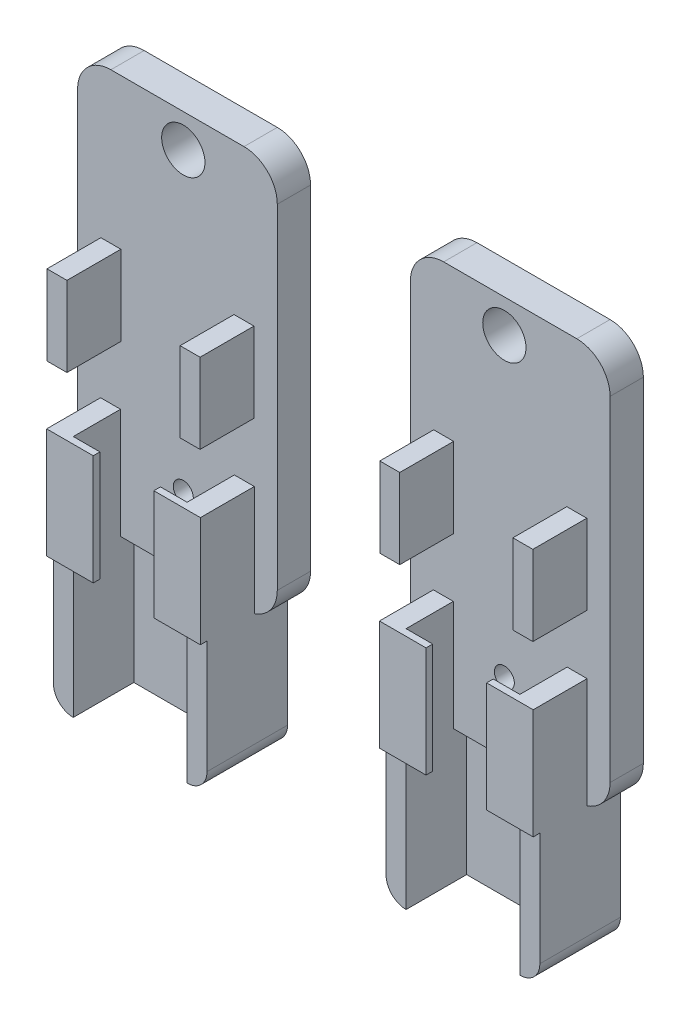
from build123d import *

# Parameters (mm, degrees)
SKETCH_1_W          = 30
SKETCH_1_H          = 60
EXTRUDE_1_DEPTH     = 5
SKETCH_2_R          = 3.25
SKETCH_2_R_2        = 1.5
CUT_EXTRUDE_1_DEPTH = 10
SKETCH_3_W          = 3
SKETCH_3_H          = 16.55
SKETCH_3_W_2        = 2.999297591
SKETCH_3_H_2        = 12
EXTRUDE_2_DEPTH     = 8.1
SKETCH_4_W          = 1
SKETCH_4_H          = 16.55
EXTRUDE_3_DEPTH     = 4
SKETCH_5_W          = 1
SKETCH_5_H          = 16.55
EXTRUDE_4_DEPTH     = 4
EXTRUDE_5_DEPTH     = 20
FILLET_3_R          = 5
FILLET_5_R          = 3
FILLET_6_R          = 5
FILLET_7_R          = 3


with BuildPart() as part:
    # 스케치1 → 보스-돌출1 (new body)
    with BuildSketch(Plane.XY):
        with Locations((15, -30)):
            Rectangle(SKETCH_1_W, SKETCH_1_H)
    extrude(amount=EXTRUDE_1_DEPTH)

    # 스케치2 → 컷-돌출1 (cut)
    with BuildSketch(Plane.XY.offset(5)):
        with Locations((15.88, -5)):
            Circle(SKETCH_2_R)
        with Locations((15.88, -49.5)):
            Circle(SKETCH_2_R_2)
    extrude(amount=-CUT_EXTRUDE_1_DEPTH, mode=Mode.SUBTRACT)

    # 스케치3 → 보스-돌출2 (add)
    with BuildSketch(Plane.XY.offset(5)):
        with Locations((4.95, -51.725)):
            Rectangle(SKETCH_3_W, SKETCH_3_H)
        with Locations((25.049648796, -51.725)):
            Rectangle(SKETCH_3_W_2, SKETCH_3_H)
        with Locations((5, -28.602177849)):
            Rectangle(SKETCH_3_W, SKETCH_3_H_2)
        with Locations((25, -28.602177849)):
            Rectangle(SKETCH_3_W, SKETCH_3_H_2)
    extrude(amount=EXTRUDE_2_DEPTH)

    # 스케치4 → 보스-돌출3 (add)
    with BuildSketch(Plane(origin=(6.45, 0, 0), x_dir=(0, 0, -1), z_dir=(1, 0, 0))):
        with Locations((-12.6, -51.725)):
            Rectangle(SKETCH_4_W, SKETCH_4_H)
    extrude(amount=EXTRUDE_3_DEPTH)

    # 스케치5 → 보스-돌출4 (add)
    with BuildSketch(Plane.ZY.offset(-23.55)):
        with Locations((12.6, -51.725)):
            Rectangle(SKETCH_5_W, SKETCH_5_H)
    extrude(amount=EXTRUDE_4_DEPTH)

    # 스케치6 → 보스-돌출5 (add)
    with BuildSketch(Plane.XZ.offset(60)):
        Polygon((3.45, 0), (26.549297591, 0), (26.549297591, 3), (26.549297591, 12.1), (23.55, 12.1), (23.55, 3), (6.45, 3), (6.45, 12.1), (3.45, 12.1), (3.45, 3), align=None)
    extrude(amount=EXTRUDE_5_DEPTH)


with BuildPart() as body_2:
    # 대칭 복사8: mirrored copy
    add(part.part.mirror(Plane(origin=(40, 0, 0), x_dir=(0, 0, 1), z_dir=(1, 0, 0))))

    # 필렛6
    # the kernel refuses this fillet: 5 mm, written as the material it takes off along each edge
    with BuildSketch(Plane(origin=(50, -60, -11.884779388), x_dir=(0, 1, 0), z_dir=(0, 0, 1))) as fillet_6_piece_1:
        with BuildLine():
            CenterArc((4.753911755, -5), FILLET_6_R, 90, 71.949235391)
            Line((0, -3.450702409), (-0.095078235, -3.419716457))
            ThreePointArc((-0.095078235, -3.419716457), (-0.1, -1.725351205), (-0.1, 0))
            Line((-0.1, 0), (0, 0.1))
            Line((0, 0.1), (4.753911755, 0.1))
            Line((4.753911755, 0.1), (4.753911755, 0))
        make_face()
    extrude(amount=28.769558776, mode=Mode.SUBTRACT)
    with BuildSketch(Plane(origin=(80, -60, -11.884206957), x_dir=(0, 1, 0), z_dir=(0, 0, 1))) as fillet_6_piece_2:
        with BuildLine():
            CenterArc((4.753682783, 5), FILLET_6_R, 198.059230491, 71.940769509)
            Line((0, 3.45), (-0.095073656, 3.419))
            ThreePointArc((-0.095073656, 3.419), (-0.1, 1.725), (-0.1, 0))
            Line((-0.1, 0), (0, -0.1))
            Line((0, -0.1), (4.753682783, -0.1))
            Line((4.753682783, -0.1), (4.753682783, 0))
        make_face()
    extrude(amount=28.768413914, mode=Mode.SUBTRACT)
    with BuildSketch(Plane(origin=(50, 0, -12.5), x_dir=(1, 0, 0), z_dir=(0, 0, 1))) as fillet_6_piece_3:
        with BuildLine():
            CenterArc((FILLET_6_R, -FILLET_6_R), FILLET_6_R, 90, 90)
            Line((0, -FILLET_6_R), (-FILLET_6_R * 0.02, -FILLET_6_R))
            Line((-FILLET_6_R * 0.02, -FILLET_6_R), (-FILLET_6_R * 0.02, FILLET_6_R * 0.02))
            Line((-FILLET_6_R * 0.02, FILLET_6_R * 0.02), (FILLET_6_R, FILLET_6_R * 0.02))
            Line((FILLET_6_R, FILLET_6_R * 0.02), (FILLET_6_R, 0))
        make_face()
    extrude(amount=30, mode=Mode.SUBTRACT)
    with BuildSketch(Plane(origin=(80, 0, -12.5), x_dir=(-1, 0, 0), z_dir=(0, 0, 1))) as fillet_6_piece_4:
        with BuildLine():
            CenterArc((FILLET_6_R, FILLET_6_R), FILLET_6_R, 180, 90)
            Line((0, FILLET_6_R), (-FILLET_6_R * 0.02, FILLET_6_R))
            Line((-FILLET_6_R * 0.02, FILLET_6_R), (-FILLET_6_R * 0.02, -FILLET_6_R * 0.02))
            Line((-FILLET_6_R * 0.02, -FILLET_6_R * 0.02), (FILLET_6_R, -FILLET_6_R * 0.02))
            Line((FILLET_6_R, -FILLET_6_R * 0.02), (FILLET_6_R, 0))
        make_face()
    extrude(amount=30, mode=Mode.SUBTRACT)

    # 필렛7
    fillet_7_edges = [body_2.edges().sort_by_distance(p)[0] for p in [
        (53.450702409, -80, 6.05),
        (76.55, -80, 6.05),
    ]]
    fillet(fillet_7_edges, radius=FILLET_7_R)


with BuildPart() as part_1:
    add(part.part)

    # 필렛3
    # the kernel refuses this fillet: 5 mm, written as the material it takes off along each edge
    with BuildSketch(Plane(origin=(30, -60, -11.884779388), x_dir=(0, 1, 0), z_dir=(0, 0, 1))) as fillet_3_piece_1:
        with BuildLine():
            CenterArc((4.753911755, 5), FILLET_3_R, 198.050764609, 71.949235391)
            Line((0, 3.450702409), (-0.095078235, 3.419716457))
            ThreePointArc((-0.095078235, 3.419716457), (-0.1, 1.725351205), (-0.1, 0))
            Line((-0.1, 0), (0, -0.1))
            Line((0, -0.1), (4.753911755, -0.1))
            Line((4.753911755, -0.1), (4.753911755, 0))
        make_face()
    extrude(amount=28.769558776, mode=Mode.SUBTRACT)
    with BuildSketch(Plane(origin=(0, -60, -11.884206957), x_dir=(0, 1, 0), z_dir=(0, 0, 1))) as fillet_3_piece_2:
        with BuildLine():
            CenterArc((4.753682783, -5), FILLET_3_R, 90, 71.940769509)
            Line((0, -3.45), (-0.095073656, -3.419))
            ThreePointArc((-0.095073656, -3.419), (-0.1, -1.725), (-0.1, 0))
            Line((-0.1, 0), (0, 0.1))
            Line((0, 0.1), (4.753682783, 0.1))
            Line((4.753682783, 0.1), (4.753682783, 0))
        make_face()
    extrude(amount=28.768413914, mode=Mode.SUBTRACT)
    with BuildSketch(Plane(origin=(30, 0, -12.5), x_dir=(-1, 0, 0), z_dir=(0, 0, 1))) as fillet_3_piece_3:
        with BuildLine():
            CenterArc((FILLET_3_R, FILLET_3_R), FILLET_3_R, 180, 90)
            Line((0, FILLET_3_R), (-FILLET_3_R * 0.02, FILLET_3_R))
            Line((-FILLET_3_R * 0.02, FILLET_3_R), (-FILLET_3_R * 0.02, -FILLET_3_R * 0.02))
            Line((-FILLET_3_R * 0.02, -FILLET_3_R * 0.02), (FILLET_3_R, -FILLET_3_R * 0.02))
            Line((FILLET_3_R, -FILLET_3_R * 0.02), (FILLET_3_R, 0))
        make_face()
    extrude(amount=30, mode=Mode.SUBTRACT)
    with BuildSketch(Plane(origin=(0, 0, -12.5), x_dir=(1, 0, 0), z_dir=(0, 0, 1))) as fillet_3_piece_4:
        with BuildLine():
            CenterArc((FILLET_3_R, -FILLET_3_R), FILLET_3_R, 90, 90)
            Line((0, -FILLET_3_R), (-FILLET_3_R * 0.02, -FILLET_3_R))
            Line((-FILLET_3_R * 0.02, -FILLET_3_R), (-FILLET_3_R * 0.02, FILLET_3_R * 0.02))
            Line((-FILLET_3_R * 0.02, FILLET_3_R * 0.02), (FILLET_3_R, FILLET_3_R * 0.02))
            Line((FILLET_3_R, FILLET_3_R * 0.02), (FILLET_3_R, 0))
        make_face()
    extrude(amount=30, mode=Mode.SUBTRACT)

    # 필렛5
    fillet_5_edges = [part_1.edges().sort_by_distance(p)[0] for p in [
        (3.45, -80, 6.05),
        (26.549297591, -80, 6.05),
    ]]
    fillet(fillet_5_edges, radius=FILLET_5_R)


solid = Compound([body_2.part, part_1.part])
